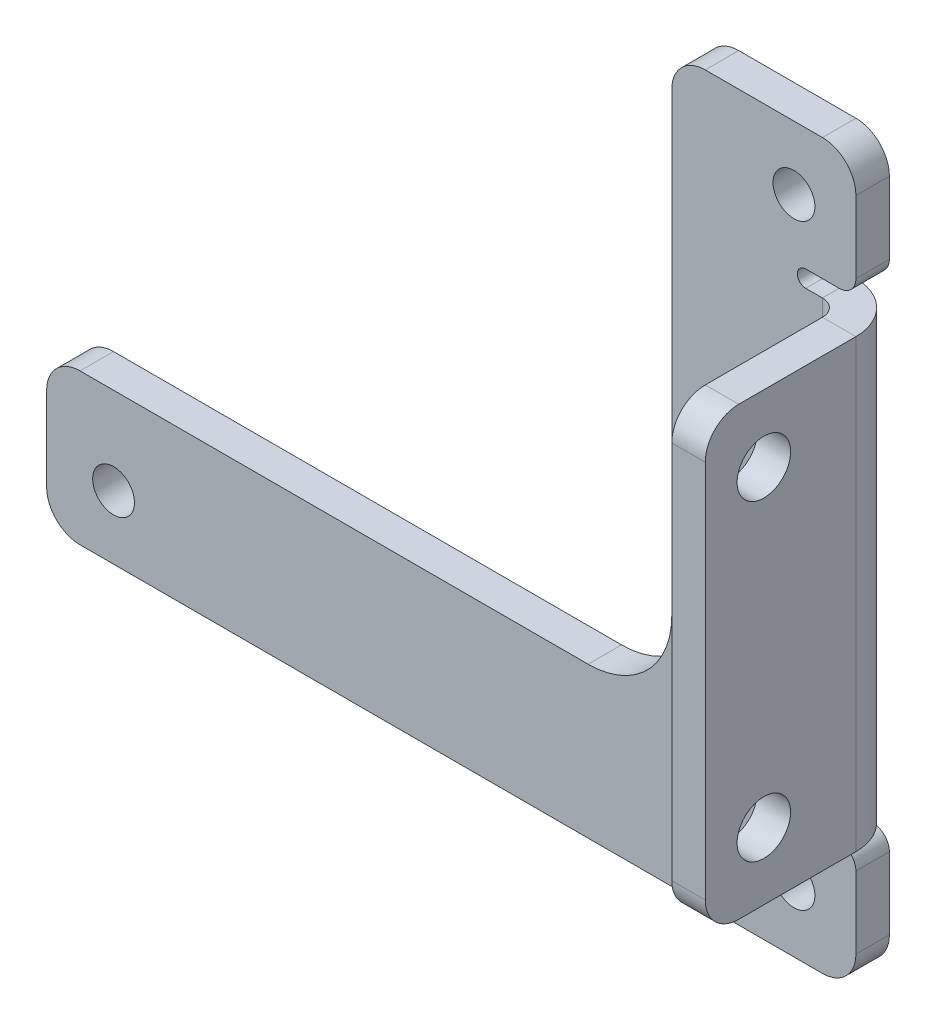
from build123d import *

# Parameters (mm, degrees)
SKETCH1_W                 = 47.35
SKETCH1_H                 = 43.25
BOSS_EXTRUDE2_DEPTH       = 2
EDGE_FLANGE1_START        = -2
EDGE_FLANGE1_OUTLINE_W    = 1
EDGE_FLANGE1_OUTLINE_H    = 2
EDGE_FLANGE1_DEPTH        = 2
EDGE_FLANGE1_START_2      = -1
EDGE_FLANGE1_2_DEPTH      = 3.69178
EDGE_FLANGE1_3_OUTLINE_W  = 2
EDGE_FLANGE1_3_OUTLINE_H  = 26.65
EDGE_FLANGE1_3_DEPTH      = 12
EDGE_FLANGE1_START_3      = 8.3
EDGE_FLANGE1_4_DEPTH      = 26.65
EDGE_FLANGE1_5_DEPTH      = 26.65
EDGE_FLANGE1_START_4      = 47.35
EDGE_FLANGE1_6_OUTLINE_R  = 1.6
EDGE_FLANGE1_6_DEPTH      = 2
REDONDEO1_R               = 2
TALADRO_ROSCADO_M31_D     = 2.5
TALADRO_ROSCADO_M31_DEPTH = 8.5
TALADRO_ROSCADO_M31_TIP   = 0.751075774
CROQUIS4_W                = 37.35
CROQUIS4_H                = 34.25
CORTAR_EXTRUIR1_DEPTH     = 67.377594111
CROQUIS14_W               = 2
CROQUIS14_H               = 7.3
SALIENTE_EXTRUIR1_DEPTH   = 1
FILLET1_R                 = 2
REDONDEO2_R               = 5
REDONDEO3_R               = 1


with BuildPart() as part:
    # Sketch1 → Boss-Extrude2 (new body)
    with BuildSketch(Plane.XY):
        with Locations((23.675, 21.625)):
            Rectangle(SKETCH1_W, SKETCH1_H)
    extrude(amount=BOSS_EXTRUDE2_DEPTH)

    # Edge-Flange1: read off the stored shape, not the designer's step
    # Edge-Flange1 outline → Edge-Flange1 (cut)
    with BuildSketch(Plane(origin=(47.35, 0, 2), x_dir=(0, 1, 0), z_dir=(1, 0, 0)).offset(EDGE_FLANGE1_START)):
        with Locations((35.45, -1)):
            Rectangle(EDGE_FLANGE1_OUTLINE_W, EDGE_FLANGE1_OUTLINE_H)
        with Locations((7.8, -1)):
            Rectangle(EDGE_FLANGE1_OUTLINE_W, EDGE_FLANGE1_OUTLINE_H)
    extrude(amount=EDGE_FLANGE1_DEPTH, mode=Mode.SUBTRACT)

    # Edge-Flange1 2 outline → Edge-Flange1 2 (cut)
    with BuildSketch(Plane.XY.offset(EDGE_FLANGE1_START_2)):
        with BuildLine():
            ThreePointArc((45.35, 35.95), (44.85, 35.45), (45.35, 34.95))
            Line((45.35, 34.95), (45.35, 35.95))
        make_face()
        with BuildLine():
            ThreePointArc((45.35, 8.3), (44.85, 7.8), (45.35, 7.3))
            Line((45.35, 7.3), (45.35, 8.3))
        make_face()
    extrude(amount=EDGE_FLANGE1_2_DEPTH, mode=Mode.SUBTRACT)

    # Edge-Flange1 3 outline → Edge-Flange1 3 (add)
    with BuildSketch(Plane.XY):
        with Locations((48.35, 21.625)):
            Rectangle(EDGE_FLANGE1_3_OUTLINE_W, EDGE_FLANGE1_3_OUTLINE_H)
    extrude(amount=EDGE_FLANGE1_3_DEPTH)

    # Edge-Flange1 4 outline → Edge-Flange1 4 (add)
    with BuildSketch(Plane(origin=(0, 0, 0), x_dir=(1, 0, 0), z_dir=(0, 1, 0)).offset(EDGE_FLANGE1_START_3)):
        with BuildLine():
            ThreePointArc((46.35, -2), (47.057106781, -2.292893219), (47.35, -3))
            Line((47.35, -3), (47.35, -2))
            Line((47.35, -2), (46.35, -2))
        make_face()
    extrude(amount=EDGE_FLANGE1_4_DEPTH)

    # Edge-Flange1 5 outline → Edge-Flange1 5 (cut)
    with BuildSketch(Plane(origin=(0, 0, 0), x_dir=(1, 0, 0), z_dir=(0, 1, 0)).offset(EDGE_FLANGE1_START_3)):
        with BuildLine():
            ThreePointArc((46.35, 0), (48.471320344, -0.878679656), (49.35, -3))
            Line((49.35, -3), (49.35, 0))
            Line((49.35, 0), (46.35, 0))
        make_face()
    extrude(amount=EDGE_FLANGE1_5_DEPTH, mode=Mode.SUBTRACT)

    # Edge-Flange1 6 outline → Edge-Flange1 6 (cut)
    with BuildSketch(Plane.YZ.offset(EDGE_FLANGE1_START_4)):
        with Locations((12.3, 8.5)):
            Circle(EDGE_FLANGE1_6_OUTLINE_R)
        with Locations((30.95, 8.5)):
            Circle(EDGE_FLANGE1_6_OUTLINE_R)
    extrude(amount=EDGE_FLANGE1_6_DEPTH, mode=Mode.SUBTRACT)

    # Redondeo1
    redondeo1_edges = [part.edges().sort_by_distance(p)[0] for p in [
        (48.35, 8.3, 12),
        (48.35, 34.95, 12),
    ]]
    fillet(redondeo1_edges, radius=REDONDEO1_R)

    # Taladro roscado M31
    with Locations(Plane(origin=(0, 0, 0), x_dir=(-1, 0, 0), z_dir=(0, 0, -1))):
        with Locations((-44.65, 39.45), (-4, 3.8), (-44.65, 3.8)):
            Hole(TALADRO_ROSCADO_M31_D / 2, depth=TALADRO_ROSCADO_M31_DEPTH)
            with Locations((0, 0, -(TALADRO_ROSCADO_M31_DEPTH + TALADRO_ROSCADO_M31_TIP / 2))):  # 118° drill point
                Cone(0, TALADRO_ROSCADO_M31_D / 2, TALADRO_ROSCADO_M31_TIP, mode=Mode.SUBTRACT)

    # Croquis4 → Cortar-Extruir1 (cut, through all)
    with BuildSketch(Plane.XY.offset(2)):
        with Locations((18.675, 26.125)):
            Rectangle(CROQUIS4_W, CROQUIS4_H)
    extrude(amount=-CORTAR_EXTRUIR1_DEPTH, mode=Mode.SUBTRACT)

    # Croquis14 → Saliente-Extruir1 (add)
    with BuildSketch(Plane(origin=(47.35, 0, 0), x_dir=(0, 0, -1), z_dir=(1, 0, 0))):
        with Locations((-1, 3.65)):
            Rectangle(CROQUIS14_W, CROQUIS14_H)
        with Locations((-1, 39.6)):
            Rectangle(CROQUIS14_W, CROQUIS14_H)
    extrude(amount=SALIENTE_EXTRUIR1_DEPTH)

    # Fillet1
    fillet1_edges = [part.edges().sort_by_distance(p)[0] for p in [
        (0, 9, 1),
        (37.35, 43.25, 1),
        (48.35, 0, 1),
        (48.35, 43.25, 1),
        (0, 0, 1),
    ]]
    fillet(fillet1_edges, radius=FILLET1_R)

    # Redondeo2
    redondeo2_edges = [part.edges().sort_by_distance(p)[0] for p in [
        (37.35, 9, 1),
    ]]
    fillet(redondeo2_edges, radius=REDONDEO2_R)

    # Redondeo3
    redondeo3_edges = [part.edges().sort_by_distance(p)[0] for p in [
        (48.35, 7.3, 1),
        (48.35, 35.95, 1),
    ]]
    fillet(redondeo3_edges, radius=REDONDEO3_R)


solid = part.part
